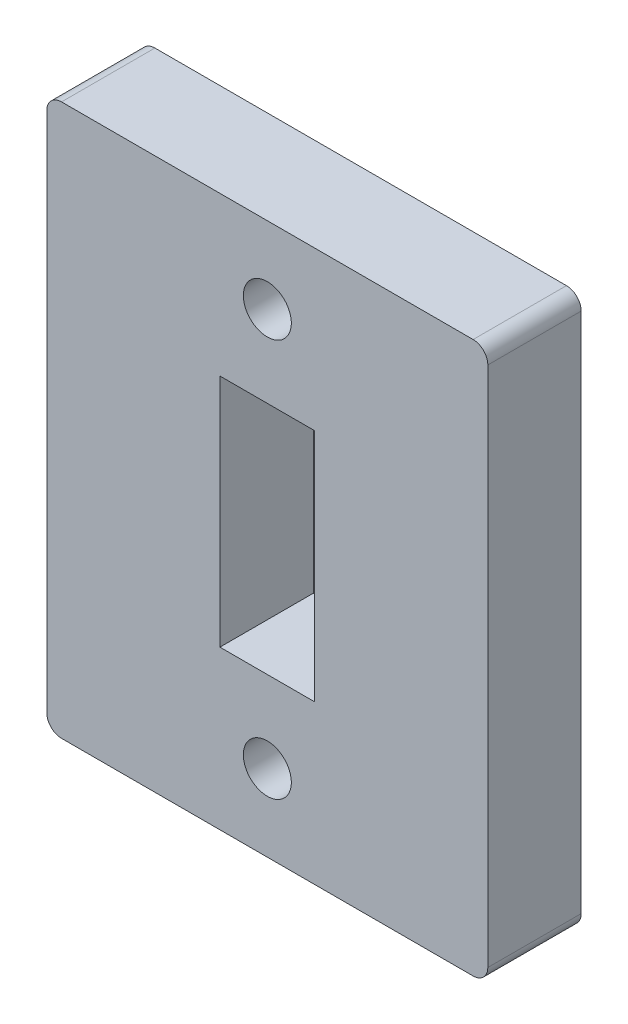
from build123d import *

# Parameters (mm, degrees)
SKETCH1_W                                        = 60
SKETCH1_H                                        = 75
BOSS_EXTRUDE1_DEPTH                              = 12.7
CSK_FOR_1_4_FLAT_HEAD_MACHINE_SCREW1_D           = 6.5278
CSK_FOR_1_4_FLAT_HEAD_MACHINE_SCREW1_CSINK_D     = 12.8778
CSK_FOR_1_4_FLAT_HEAD_MACHINE_SCREW1_CSINK_ANGLE = 82
FILLET1_R                                        = 2


with BuildPart() as part:
    # Sketch1 → Boss-Extrude1 (new body)
    with BuildSketch(Plane.XY):
        with Locations((30, -37.5)):
            Rectangle(SKETCH1_W, SKETCH1_H)
        Polygon((30, -21.525), (36.45, -21.525), (36.45, -53.475), (30, -53.475), (23.55, -53.475), (23.55, -21.525), align=None, mode=Mode.SUBTRACT)
    extrude(amount=BOSS_EXTRUDE1_DEPTH)

    # CSK for 1/4 Flat Head Machine Screw1 (through all)
    with Locations(Plane(origin=(0, 0, 0), x_dir=(-1, 0, 0), z_dir=(0, 0, -1))):
        with Locations((-30, -10.44), (-30, -64.56)):
            CounterSinkHole(CSK_FOR_1_4_FLAT_HEAD_MACHINE_SCREW1_D / 2, CSK_FOR_1_4_FLAT_HEAD_MACHINE_SCREW1_CSINK_D / 2, counter_sink_angle=CSK_FOR_1_4_FLAT_HEAD_MACHINE_SCREW1_CSINK_ANGLE)

    # Fillet1
    fillet1_edges = [part.edges().sort_by_distance(p)[0] for p in [
        (0, 0, 6.35),
        (60, 0, 6.35),
        (0, -75, 6.35),
        (60, -75, 6.35),
    ]]
    fillet(fillet1_edges, radius=FILLET1_R)


solid = part.part
